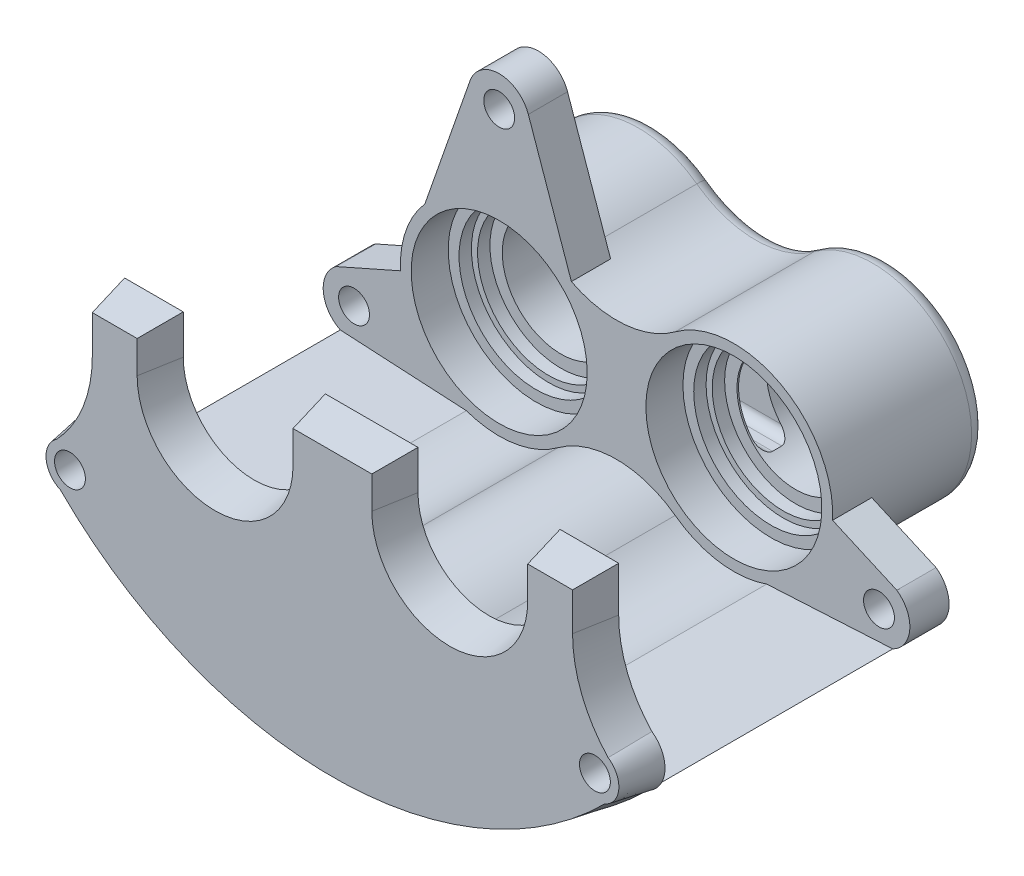
from build123d import *

# Parameters (mm, degrees)
BOSS_EXTRUDE1_DEPTH                 = 12.5
CUT_EXTRUDE1_REACH                  = 42.463
CUT_EXTRUDE1_END_RADIUS             = 9.5
CUT_EXTRUDE1_DIRECTION_2_REACH      = 42.463
CUT_EXTRUDE1_DIRECTION_2_END_RADIUS = 9.5
BOSS_EXTRUDE3_DEPTH                 = 6.35
SKETCH5_R                           = 2.5
BOSS_EXTRUDE4_DEPTH                 = 6.35
BOSS_EXTRUDE5_START                 = -46
BOSS_EXTRUDE5_DEPTH                 = 46
BOSS_EXTRUDE6_DEPTH                 = 6.35
BOSS_EXTRUDE6_DRAFT                 = 10
HOLE1_START                         = 6.15
HOLE1_OUTLINE_R                     = 2.5
HOLE1_DEPTH                         = 52.35
FILLET1_R                           = 2.5


# Read off the part's stored shape, not the designer's step: Hole1
with BuildPart() as part:
    # Sketch1 → Boss-Extrude1 (new, symmetric)
    with BuildSketch(Plane.XY):
        with BuildLine():
            ThreePointArc((-9.5, 12.87439319), (-35, 0), (-9.5, -12.87439319))
            ThreePointArc((-9.5, -12.87439319), (0, -9.748786379), (9.5, -12.87439319))
            ThreePointArc((9.5, -12.87439319), (35, 0), (9.5, 12.87439319))
            ThreePointArc((9.5, 12.87439319), (0, 9.748786379), (-9.5, 12.87439319))
        make_face()
    extrude(amount=BOSS_EXTRUDE1_DEPTH, both=True)

    # Sketch2 → Cut-Revolve1 (revolve, cut)
    with BuildSketch(Plane(origin=(19, 0, 0), x_dir=(0, 0, -1), z_dir=(1, 0, 0)), mode=Mode.PRIVATE) as cut_revolve1_sk:
        Polygon((-12.5, 0), (-12.5, 14.25), (-6.5, 14.25), (-6.5, 12.5), (-4.5, 12.5), (-4.5, 11.5), (-2.5, 11.5), (-2.5, 9.5), (9.5, 9.5), (9.5, 4.5), (8.5, 4.5), (8.5, 0), align=None)
    cut_revolve1 = revolve(cut_revolve1_sk.sketch.rotate(Axis((19, 0, 0), (0, 0, 1)), 90), axis=Axis((19, 0, 0), (0, 0, 1)), mode=Mode.SUBTRACT)

    # Mirror1: Cut-Revolve1 across plane
    add(cut_revolve1.mirror(Plane(origin=(0, 0, 0), x_dir=(0, 0, 1), z_dir=(1, 0, 0))), mode=Mode.SUBTRACT)

    # Cut-Extrude1: up to this cylinder (the profile starts outside it)
    cut_extrude1_end = Plane(origin=(-19, 0, 0), z_dir=(0, 0, -1)) * Cylinder(CUT_EXTRUDE1_END_RADIUS, 104.926, mode=Mode.PRIVATE)
    # Sketch3 → Cut-Extrude1 (cut, up to the surface)
    with BuildSketch(Plane(origin=(0, 0, 0), x_dir=(0, 0, -1), z_dir=(1, 0, 0)), mode=Mode.PRIVATE) as cut_extrude1_sk1:
        with BuildLine():
            Line((0.75, -7.75), (-0.75, -7.75))
            ThreePointArc((-0.75, -7.75), (-1.810660172, -7.310660172), (-2.25, -6.25))
            Line((-2.25, -6.25), (-2.25, 6.25))
            ThreePointArc((-2.25, 6.25), (-1.810660172, 7.310660172), (-0.75, 7.75))
            Line((-0.75, 7.75), (0.75, 7.75))
            ThreePointArc((0.75, 7.75), (1.810660172, 7.310660172), (2.25, 6.25))
            Line((2.25, 6.25), (2.25, -6.25))
            ThreePointArc((2.25, -6.25), (1.810660172, -7.310660172), (0.75, -7.75))
        make_face()
    cut_extrude1_tool1 = extrude(cut_extrude1_sk1.sketch, amount=-CUT_EXTRUDE1_REACH, mode=Mode.PRIVATE) - cut_extrude1_end
    add(cut_extrude1_tool1.solids().sort_by_distance((0, 0, 0))[0], mode=Mode.SUBTRACT)

    # Cut-Extrude1 direction 2: up to this cylinder (the profile starts outside it)
    cut_extrude1_direction_2_end = Plane(origin=(19, 0, 0), z_dir=(0, 0, -1)) * Cylinder(CUT_EXTRUDE1_DIRECTION_2_END_RADIUS, 104.926, mode=Mode.PRIVATE)
    # Sketch3 → Cut-Extrude1 direction 2 (cut, up to the surface)
    with BuildSketch(Plane(origin=(0, 0, 0), x_dir=(0, 0, -1), z_dir=(1, 0, 0)), mode=Mode.PRIVATE) as cut_extrude1_direction_2_sk1:
        with BuildLine():
            Line((0.75, -7.75), (-0.75, -7.75))
            ThreePointArc((-0.75, -7.75), (-1.810660172, -7.310660172), (-2.25, -6.25))
            Line((-2.25, -6.25), (-2.25, 6.25))
            ThreePointArc((-2.25, 6.25), (-1.810660172, 7.310660172), (-0.75, 7.75))
            Line((-0.75, 7.75), (0.75, 7.75))
            ThreePointArc((0.75, 7.75), (1.810660172, 7.310660172), (2.25, 6.25))
            Line((2.25, 6.25), (2.25, -6.25))
            ThreePointArc((2.25, -6.25), (1.810660172, -7.310660172), (0.75, -7.75))
        make_face()
    cut_extrude1_direction_2_tool1 = extrude(cut_extrude1_direction_2_sk1.sketch, amount=CUT_EXTRUDE1_DIRECTION_2_REACH, mode=Mode.PRIVATE) - cut_extrude1_direction_2_end
    add(cut_extrude1_direction_2_tool1.solids().sort_by_distance((0, 0, 0))[0], mode=Mode.SUBTRACT)

    # Sketch4 → Boss-Extrude3 (add)
    with BuildSketch(Plane.XY.offset(12.5)):
        with BuildLine():
            Line((-45.380476721, -5.413087491), (-34.979470203, -0.810266645))
            ThreePointArc((-34.979470203, -0.810266645), (-31.820655502, -9.572397426), (-24.317188777, -15.090642912))
            Line((-24.317188777, -15.090642912), (-44.730811053, -13.974760557))
            ThreePointArc((-44.730811053, -13.974760557), (-47.485667167, -9.87831587), (-45.380476721, -5.413087491))
        make_face()
    boss_extrude3 = extrude(amount=-BOSS_EXTRUDE3_DEPTH)

    # Mirror2: Boss-Extrude3 across plane
    add(boss_extrude3.mirror(Plane(origin=(0, 0, 0), x_dir=(0, 0, 1), z_dir=(1, 0, 0))))

    # Sketch5 → Boss-Extrude4 (add)
    with BuildSketch(Plane.XY.offset(12.5)):
        with BuildLine():
            ThreePointArc((-14.279554898, 31.478453226), (-19, 34.83), (-23.720445102, 31.478453226))
            Line((-23.720445102, 31.478453226), (-31.028962191, 10.550074342))
            ThreePointArc((-31.028962191, 10.550074342), (-20.717418693, 15.907560248), (-9.5, 12.87439319))
            ThreePointArc((-9.5, 12.87439319), (-8.431487389, 12.150623988), (-7.308118696, 11.515325762))
            Line((-7.308118696, 11.515325762), (-14.279554898, 31.478453226))
        make_face()
        with Locations((-19, 29.83)):
            Circle(SKETCH5_R, mode=Mode.SUBTRACT)
    extrude(amount=-BOSS_EXTRUDE4_DEPTH)

    # Sketch6 → Boss-Extrude5 (add)
    with BuildSketch(Plane(origin=(0, 0, 6.15), x_dir=(-1, 0, 0), z_dir=(0, 0, -1)).offset(BOSS_EXTRUDE5_START)):
        with BuildLine():
            Line((44.730811053, -13.974760557), (24.317188777, -15.090642912))
            ThreePointArc((24.317188777, -15.090642912), (16.633162841, -15.823971747), (9.5, -12.87439319))
            ThreePointArc((9.5, -12.87439319), (0, -9.748786379), (-9.5, -12.87439319))
            ThreePointArc((-9.5, -12.87439319), (-16.633162841, -15.823971747), (-24.317188777, -15.090642912))
            Line((-24.317188777, -15.090642912), (-44.730811053, -13.974760557))
            ThreePointArc((-44.730811053, -13.974760557), (0, -32.403655151), (44.730811053, -13.974760557))
        make_face()
    extrude(amount=BOSS_EXTRUDE5_DEPTH)


with BuildPart() as boss_extrude6_tool:
    # Sketch7 → Boss-Extrude6 (with draft: the straight prism first)
    with BuildSketch(Plane.XY.offset(52.15)):
        with BuildLine():
            Line((-7.5, 15.5), (-7.5, 9.15))
            ThreePointArc((-7.5, 9.15), (-19, -2.35), (-30.5, 9.15))
            Line((-30.5, 9.15), (-30.5, 15.5))
            Line((-30.5, 15.5), (-40, 15.5))
            Line((-40, 15.5), (-40, 8.234972412))
            ThreePointArc((-40, 8.234972412), (-41.393677612, 0.899799121), (-45.380476721, -5.413087491))
            ThreePointArc((-45.380476721, -5.413087491), (-47.485667167, -9.87831587), (-44.730811053, -13.974760557))
            ThreePointArc((-44.730811053, -13.974760557), (0, -32.403655151), (44.730811053, -13.974760557))
            ThreePointArc((44.730811053, -13.974760557), (47.485667167, -9.87831587), (45.380476721, -5.413087491))
            ThreePointArc((45.380476721, -5.413087491), (41.393677612, 0.899799121), (40, 8.234972412))
            Line((40, 8.234972412), (40, 15.5))
            Line((40, 15.5), (30.5, 15.5))
            Line((30.5, 15.5), (30.5, 9.15))
            ThreePointArc((30.5, 9.15), (19, -2.35), (7.5, 9.15))
            Line((7.5, 9.15), (7.5, 15.5))
            Line((7.5, 15.5), (-7.5, 15.5))
        make_face()
    extrude(amount=BOSS_EXTRUDE6_DEPTH)
    # Boss-Extrude6: the draft: its side faces are tilted about the plane it starts from
    boss_extrude6_sides = [boss_extrude6_tool.faces().sort_by_distance(p)[0] for p in [
        (0, -32.403655151, 55.325),
        (47.485667167, -9.87831587, 55.325),
        (41.393677612, 0.899799121, 55.325),
        (40, 11.867486206, 55.325),
        (35.25, 15.5, 55.325),
        (30.5, 12.325, 55.325),
        (19, -2.35, 55.325),
        (7.5, 12.325, 55.325),
        (0, 15.5, 55.325),
        (-7.5, 12.325, 55.325),
        (-19, -2.35, 55.325),
        (-30.5, 12.325, 55.325),
        (-35.25, 15.5, 55.325),
        (-40, 11.867486206, 55.325),
        (-41.393677612, 0.899799121, 55.325),
        (-47.485667167, -9.87831587, 55.325),
    ]]
    draft(boss_extrude6_sides, Plane.XY.offset(52.15), BOSS_EXTRUDE6_DRAFT)


with BuildPart() as part_1:
    add(part.part)

    # Boss-Extrude6: add boss_extrude6_tool
    add(boss_extrude6_tool.part)

    # Hole1 outline → Hole1 (cut)
    with BuildSketch(Plane.XY.offset(HOLE1_START)):
        with Locations((42.5, -9.5)):
            Circle(HOLE1_OUTLINE_R)
    hole1 = extrude(amount=HOLE1_DEPTH, mode=Mode.SUBTRACT)

    # Mirror3: Hole1 across plane
    add(hole1.mirror(Plane(origin=(0, 0, 0), x_dir=(0, 0, 1), z_dir=(1, 0, 0))), mode=Mode.SUBTRACT)

    # Fillet1
    fillet1_edges = [part_1.edges().sort_by_distance(p)[0] for p in [
        (35, 0, -12.5),
        (0, -9.748786379, -12.5),
        (-35, 0, -12.5),
        (0, 9.748786379, -12.5),
    ]]
    fillet(fillet1_edges, radius=FILLET1_R)


solid = part_1.part
